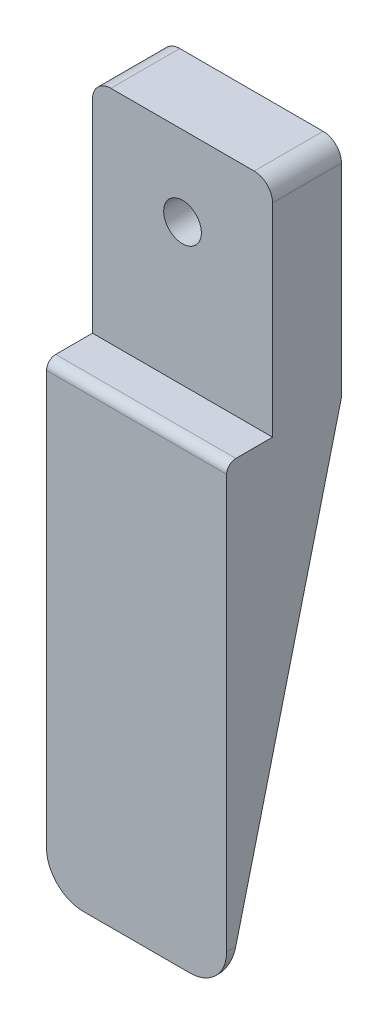
from build123d import *

# Parameters (mm, degrees)
BOSS_EXTRUDE1_DEPTH = 12.5
CUT_EXTRUDE1_REACH  = 121.367
SKETCH2_W           = 5
SKETCH2_H           = 24.080992435
CUT_EXTRUDE2_REACH  = 120.153
SKETCH3_R           = 2.05
FILLET1_R           = 2
FILLET2_R           = 1
SKETCH4_R           = 4.15
CUT_EXTRUDE3_DEPTH  = 2.5
CHAMFER1_SIZE       = 0.5


with BuildPart() as part:
    # Sketch1 → Boss-Extrude1 (new body)
    with BuildSketch(Plane.XY):
        with BuildLine():
            Line((9.8, -43), (-9.8, -43))
            Line((-9.8, -43), (-9.8, -113.080992435))
            ThreePointArc((-9.8, -113.080992435), (-8.628427125, -115.90941956), (-5.8, -117.080992435))
            Line((-5.8, -117.080992435), (5.8, -117.080992435))
            ThreePointArc((5.8, -117.080992435), (8.628427125, -115.90941956), (9.8, -113.080992435))
            Line((9.8, -113.080992435), (9.8, -43))
        make_face()
    extrude(amount=-BOSS_EXTRUDE1_DEPTH)

    # Sketch2 → Cut-Extrude1 (cut, up to next)
    with BuildSketch(Plane(origin=(9.8, 0, 0), x_dir=(0, 0, -1), z_dir=(1, 0, 0)), mode=Mode.PRIVATE) as cut_extrude1_sk1:
        with Locations((2.5, -55.040496217)):
            Rectangle(SKETCH2_W, SKETCH2_H)
    cut_extrude1_tool1 = extrude(cut_extrude1_sk1.sketch, amount=-CUT_EXTRUDE1_REACH, mode=Mode.PRIVATE) & part.part
    # Sketch2 → Cut-Extrude1 (cut, up to next)
    with BuildSketch(Plane(origin=(9.8, 0, 0), x_dir=(0, 0, -1), z_dir=(1, 0, 0)), mode=Mode.PRIVATE) as cut_extrude1_sk2:
        Polygon((12.5, -67.080992435), (0, -117.080992435), (12.5, -117.080992435), align=None)
    cut_extrude1_tool2 = extrude(cut_extrude1_sk2.sketch, amount=-CUT_EXTRUDE1_REACH, mode=Mode.PRIVATE) & part.part
    add(cut_extrude1_tool1.solids().sort_by_distance((9.8, -55.040496, -2.5))[0], mode=Mode.SUBTRACT)
    add(cut_extrude1_tool2.solids().sort_by_distance((9.8, -100.414326, -8.333333))[0], mode=Mode.SUBTRACT)

    # Sketch3 → Cut-Extrude2 (cut, up to next)
    with BuildSketch(Plane(origin=(0, 0, -12.5), x_dir=(-1, 0, 0), z_dir=(0, 0, -1)), mode=Mode.PRIVATE) as cut_extrude2_sk1:
        with Locations((0, -51.702394739)):
            Circle(SKETCH3_R)
    cut_extrude2_tool1 = extrude(cut_extrude2_sk1.sketch, amount=-CUT_EXTRUDE2_REACH, mode=Mode.PRIVATE) & part.part
    add(cut_extrude2_tool1.solids().sort_by_distance((0, -51.702395, -12.5))[0], mode=Mode.SUBTRACT)

    # Fillet1
    fillet1_edges = [part.edges().sort_by_distance(p)[0] for p in [
        (9.8, -43, -8.75),
        (-9.8, -43, -8.75),
    ]]
    fillet(fillet1_edges, radius=FILLET1_R)

    # Fillet2
    fillet2_edges = [part.edges().sort_by_distance(p)[0] for p in [
        (0, -67.080992435, 0),
    ]]
    fillet(fillet2_edges, radius=FILLET2_R)

    # Sketch4 → Cut-Extrude3 (cut)
    with BuildSketch(Plane(origin=(0, 0, -12.5), x_dir=(-1, 0, 0), z_dir=(0, 0, -1))):
        with Locations((0, -51.702394739)):
            Circle(SKETCH4_R)
    extrude(amount=-CUT_EXTRUDE3_DEPTH, mode=Mode.SUBTRACT)

    # Chamfer1
    chamfer1_edges = [part.edges().sort_by_distance(p)[0] for p in [
        (2.05, -51.702394739, -10),
        (4.15, -51.702394739, -12.5),
    ]]
    chamfer(chamfer1_edges, length=CHAMFER1_SIZE)


solid = part.part
